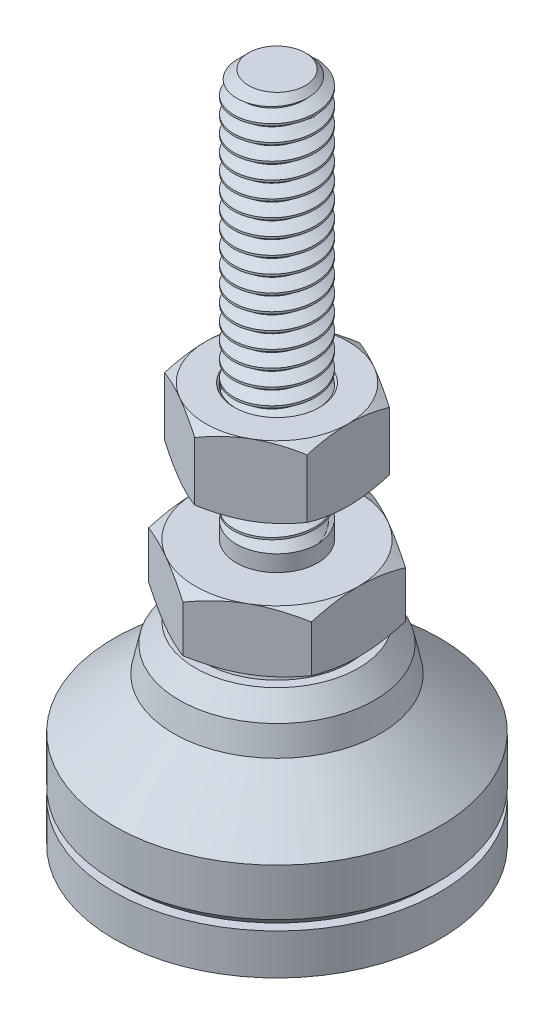
from build123d import *
from build123d.topology import SkipClean

# Parameters (mm, degrees)
BOSS_EXTRUDE1_DEPTH = 4.7625
SKETCH6_R           = 3.175
BOSS_EXTRUDE2_DEPTH = 31.75
CUT_SWEEP1_PITCH    = 1.27
SKETCH9_OUTSIDE_W   = 103.086
SKETCH9_OUTSIDE_H   = 103.086
SKETCH9_OUTSIDE_R   = 2.21262927
CUT_EXTRUDE1_DEPTH  = 31.75
CUT_EXTRUDE1_DRAFT  = -45
SKETCH10_R          = 3.175
BOSS_EXTRUDE3_DEPTH = 5.55625
SKETCH14_W          = 12.7
SKETCH14_H          = 3.175


with BuildPart() as part:
    # Sketch2 → Revolve1 (revolve)
    with BuildSketch(Plane.XY, mode=Mode.PRIVATE) as revolve1_sk:
        with BuildLine():
            Line((0, 3.175), (0, 7.747))
            ThreePointArc((0, 7.747), (-4.638543521, 10.037538611), (-5.639715241, 15.113))
            Line((-5.639715241, 15.113), (-6.35, 15.113))
            Line((-6.35, 15.113), (-7.62, 13.589))
            Line((-7.62, 13.589), (-8.0645, 11.557))
            Line((-8.0645, 11.557), (-12.7, 7.62))
            Line((-12.7, 7.62), (-12.7, 3.937))
            Line((-12.7, 3.937), (-11.938, 3.175))
            Line((-11.938, 3.175), (0, 3.175))
        make_face()
    revolve(revolve1_sk.sketch.rotate(Axis((0, 0, 0), (0, 1, 0)), 270), axis=Axis((0, 0, 0), (0, 1, 0)))


with BuildPart() as body_2:
    # Sketch12 → Revolve2 (revolve)
    with BuildSketch(Plane.XY, mode=Mode.PRIVATE) as revolve2_sk:
        with BuildLine():
            Line((0, 15.875), (-5.376166664, 15.875))
            ThreePointArc((-5.376166664, 15.875), (-4.872564828, 10.366101305), (0, 7.747))
            Line((0, 7.747), (0, 15.875))
        make_face()
    revolve(revolve2_sk.sketch.rotate(Axis((0, 15.875, 0), (0, -1, 0)), 180), axis=Axis((0, 15.875, 0), (0, -1, 0)))

    # Sketch4 → Boss-Extrude1 (add)
    with BuildSketch(Plane(origin=(0, 15.875, 0), x_dir=(1, 0, 0), z_dir=(0, 1, 0))):
        Polygon((0, 7.332348419), (-6.35, 3.666174209), (-6.35, -3.666174209), (0, -7.332348419), (6.35, -3.666174209), (6.35, 3.666174209), align=None)
    extrude(amount=BOSS_EXTRUDE1_DEPTH)

    # Sketch5 → Cut-Revolve2 (revolve, cut)
    with BuildSketch(Plane(origin=(0, 0, 0), x_dir=(0, 0, -1), z_dir=(1, 0, 0)), mode=Mode.PRIVATE) as cut_revolve2_sk:
        Polygon((-8.314696837, 20.6375), (-8.314696837, 15.875), (-6.35, 15.875), (-7.332348419, 16.442159124), (-7.332348419, 20.070340876), (-6.35, 20.6375), align=None)
    revolve(cut_revolve2_sk.sketch.rotate(Axis((0, 0, 0), (0, 1, 0)), 90), axis=Axis((0, 0, 0), (0, 1, 0)), mode=Mode.SUBTRACT)


with BuildPart() as body_3:
    # Sketch6 → Boss-Extrude2 (new body)
    with BuildSketch(Plane(origin=(0, 20.6375, 0), x_dir=(1, 0, 0), z_dir=(0, 1, 0))):
        with Locations(Location((0, 0, 0), (0, 0, 270))):
            Circle(SKETCH6_R)
    extrude(amount=BOSS_EXTRUDE2_DEPTH)

    # Cut-Sweep1: the profile of Sketch8 screwed along a right-hand helix of 26 turns, 8 arcs to a turn; built about Z, then put on its axis
    cut_sweep1_z = Axis((0, 0, 0), (0, 0, 1))
    cut_sweep1_corners = [(3.243740766, 0, -1.1509375), (2.350110803, 0, -0.635), (2.350110803, 0, -0.47625), (3.243740766, 0, 0.0396875)]
    with BuildLine(mode=Mode.PRIVATE) as cut_sweep1_profile:
        Line(cut_sweep1_corners[0], cut_sweep1_corners[1])
        Line(cut_sweep1_corners[1], cut_sweep1_corners[2])
        Line(cut_sweep1_corners[2], cut_sweep1_corners[3])
        Line(cut_sweep1_corners[3], cut_sweep1_corners[0])
    cut_sweep1_cap = Face(cut_sweep1_profile.wire())
    cut_sweep1_turn_angles = [0, 22.5, 45, 67.5, 90, 112.5, 135, 157.5, 180, 202.5, 225, 247.5, 270, 292.5, 315, 337.5, 360]
    cut_sweep1_turn_weights = [1, 0.9238795325112867, 1, 0.9238795325112867, 1, 0.9238795325112867, 1, 0.9238795325112867, 1, 0.9238795325112867, 1, 0.9238795325112867, 1, 0.9238795325112867, 1, 0.9238795325112867, 1]
    cut_sweep1_turn_rails = [Edge.make_bspline([Vector(p[0], p[1], 0).rotate(cut_sweep1_z, cut_sweep1_turn_angles[k]) / cut_sweep1_turn_weights[k] + Vector(0, 0, p[2] + CUT_SWEEP1_PITCH * cut_sweep1_turn_angles[k] / 360) for k in range(17)], [0, 0, 0, 1, 1, 2, 2, 3, 3, 4, 4, 5, 5, 6, 6, 7, 7, 8, 8, 8], 2, cut_sweep1_turn_weights) for p in cut_sweep1_corners]
    cut_sweep1_turn_sides = [Face.make_surface_from_curves(cut_sweep1_turn_rails[p[0]], cut_sweep1_turn_rails[p[1]]) for p in [(0, 1), (1, 2), (2, 3), (3, 0)]]
    cut_sweep1 = Plane(origin=(0, 52.3875, 0), x_dir=(1, 0, 0), z_dir=(0, -1, 0)) * Solid(Shell([*[p.moved(Location((0, 0, CUT_SWEEP1_PITCH * i))) for i in range(26) for p in cut_sweep1_turn_sides], cut_sweep1_cap, cut_sweep1_cap.rotate(cut_sweep1_z, 9360).moved(Location((0, 0, CUT_SWEEP1_PITCH * 9360 / 360)))]))
    add(cut_sweep1, mode=Mode.SUBTRACT)


with BuildPart() as cut_extrude1_tool:
    # Sketch9 outside → Cut-Extrude1 (with draft: the straight prism first)
    with BuildSketch(Plane(origin=(0, 52.3875, 0), x_dir=(1, 0, 0), z_dir=(0, 1, 0))):
        Rectangle(SKETCH9_OUTSIDE_W, SKETCH9_OUTSIDE_H)
        Circle(SKETCH9_OUTSIDE_R, mode=Mode.SUBTRACT)
    extrude(amount=-CUT_EXTRUDE1_DEPTH)
    # Cut-Extrude1: the draft: its side faces are tilted about the plane it starts from
    cut_extrude1_sides = [cut_extrude1_tool.faces().sort_by_distance(p)[0] for p in [
        (0, 36.5125, 51.543),
        (51.543, 36.5125, 0),
        (0, 36.5125, -51.543),
        (-51.543, 36.5125, 0),
        (-2.21262927, 36.5125, 0),
    ]]
    draft(cut_extrude1_sides, Plane(origin=(0, 52.3875, 0), x_dir=(1, 0, 0), z_dir=(0, 1, 0)), CUT_EXTRUDE1_DRAFT)


with BuildPart() as body_3_1:
    add(body_3.part)

    # Cut-Extrude1: cut by cut_extrude1_tool
    add(cut_extrude1_tool.part, mode=Mode.SUBTRACT)

    # Combine1: union body 2
    add(body_2.part)

    # Sketch13 → Revolve3 (revolve)
    with SkipClean():  # the faces are left unmerged after this step: merging them gives an invalid solid
        with BuildSketch(Plane.XY, mode=Mode.PRIVATE) as revolve3_sk:
            Polygon((0, 25.0825), (3.175, 21.9075), (3.175, 20.6375), (0, 20.6375), align=None)
        revolve(revolve3_sk.sketch.rotate(Axis((0, 25.0825, 0), (0, -1, 0)), 272.921710335), axis=Axis((0, 25.0825, 0), (0, -1, 0)))


with BuildPart() as body_3_2:
    # Sketch10 → Boss-Extrude3 (new body)
    with BuildSketch(Plane(origin=(0, 31.220833333, 0), x_dir=(-1, 0, 0), z_dir=(0, 1, 0))):
        Polygon((0, 6.415804866), (-5.55625, 3.207902433), (-5.55625, -3.207902433), (0, -6.415804866), (5.55625, -3.207902433), (5.55625, 3.207902433), align=None)
        with Locations(Location((0, 0, 0), (0, 0, 90))):
            Circle(SKETCH10_R, mode=Mode.SUBTRACT)
    extrude(amount=-BOSS_EXTRUDE3_DEPTH)

    # Sketch11 → Cut-Revolve3 (revolve, cut)
    with BuildSketch(Plane(origin=(0, 0, 0), x_dir=(0, 0, -1), z_dir=(1, 0, 0)), mode=Mode.PRIVATE) as cut_revolve3_sk:
        Polygon((-7.275359733, 25.664583333), (-7.275359733, 31.220833333), (-5.55625, 31.220833333), (-6.415804866, 30.7245691), (-6.415804866, 26.160847567), (-5.55625, 25.664583333), align=None)
        Polygon((0, 25.664583333), (0, 31.220833333), (3.33375, 31.220833333), (3.175, 31.062083333), (3.175, 25.823333333), (3.33375, 25.664583333), align=None)
    revolve(cut_revolve3_sk.sketch.rotate(Axis((0, 0, 0), (0, 1, 0)), 180), axis=Axis((0, 0, 0), (0, 1, 0)), mode=Mode.SUBTRACT)


with BuildPart() as body_4:
    # Sketch14 → Revolve4 (revolve)
    with BuildSketch(Plane.XY, mode=Mode.PRIVATE) as revolve4_sk:
        with Locations((6.35, 1.5875)):
            Rectangle(SKETCH14_W, SKETCH14_H)
    revolve(revolve4_sk.sketch.rotate(Axis((0, 0, 0), (0, 1, 0)), 87.078289665), axis=Axis((0, 0, 0), (0, 1, 0)))


solid = Compound([part.part, body_3_1.part, body_3_2.part, body_4.part])
